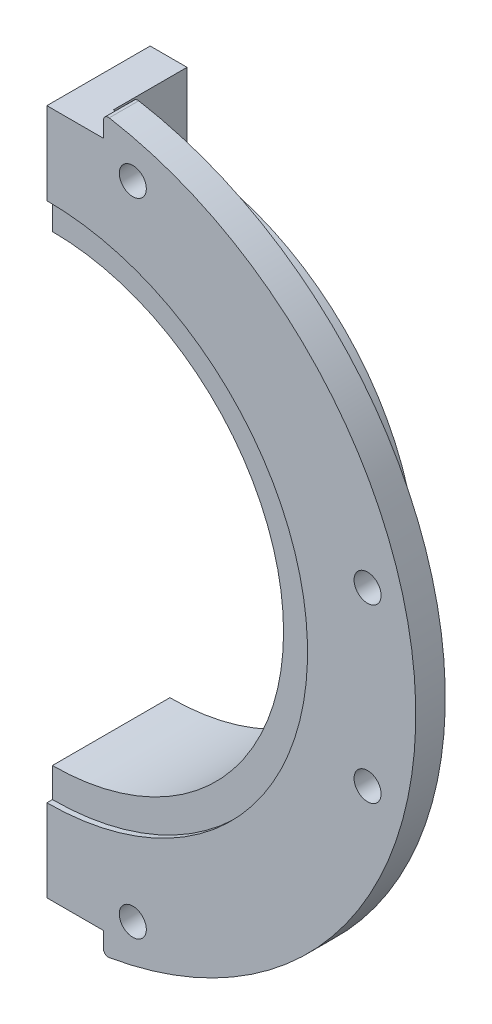
from build123d import *

# Parameters (mm, degrees)
SKETCH1_W                = 180
SKETCH1_H                = 180
BOSS_EXTRUDE1_DEPTH      = 6
SKETCH2_R                = 50.3
SKETCH2_R_2              = 46.3
BOSS_EXTRUDE2_DEPTH      = 19
CUT_EXTRUDE1_DEPTH       = 256.266527379
CUT_EXTRUDE1_DEPTH_BACK  = 256.266527379
SKETCH3_R                = 47
BOSS_EXTRUDE3_DEPTH      = 60
FILLET4_R                = 3
M5_CLEARANCE_HOLE1_D     = 5.5
CUT_EXTRUDE4_REACH       = 264.975
CUT_EXTRUDE5_REACH       = 244.499
SKETCH33_W               = 1
SKETCH33_H               = 25
SKETCH35_W               = 15
SKETCH35_H               = 20
BOSS_EXTRUDE6_DEPTH      = 15
M5_CLEARANCE_HOLE2_D     = 5.5
CUT_EXTRUDE6_DEPTH       = 4.2
CUT_EXTRUDE7_REACH       = 242.936
SKETCH41_W               = 23
SKETCH41_H               = 15
FILLET8_R                = 1
CUT_EXTRUDE8_REACH       = 197.694
SKETCH47_R               = 53
CUT_EXTRUDE10_DEPTH      = 1.12
CUT_EXTRUDE12_DEPTH      = 237.907606822
CUT_EXTRUDE12_DEPTH_BACK = 237.907606822
SKETCH51_W               = 150
SKETCH51_H               = 200
LETTERS_START            = -1
LETTERS_DEPTH            = 1


# Read off the part's stored shape, not the designer's step: letters
with BuildPart() as part:
    # Sketch1 → Boss-Extrude1 (new body)
    with BuildSketch(Plane.XY):
        with Locations((90, 90)):
            Rectangle(SKETCH1_W, SKETCH1_H)
    extrude(amount=BOSS_EXTRUDE1_DEPTH)

    # Sketch2 → Boss-Extrude2 (add)
    with BuildSketch(Plane(origin=(0, 0, 0), x_dir=(-1, 0, 0), z_dir=(0, 0, -1))):
        with Locations((-90, 90)):
            Circle(SKETCH2_R)
        with Locations((-90, 90)):
            Circle(SKETCH2_R_2, mode=Mode.SUBTRACT)
    extrude(amount=BOSS_EXTRUDE2_DEPTH)

    # Sketch3 → Cut-Extrude1 (cut, two sides: drawn at the far end of the back side and taken through both)
    with BuildSketch(Plane(origin=(0, 0, 0), x_dir=(-1, 0, 0), z_dir=(0, 0, -1)).offset(-CUT_EXTRUDE1_DEPTH_BACK)):
        with Locations((-90, 90)):
            Circle(SKETCH3_R)
    extrude(amount=CUT_EXTRUDE1_DEPTH + CUT_EXTRUDE1_DEPTH_BACK, mode=Mode.SUBTRACT)

    # Sketch4 → Boss-Extrude3 (add)
    with BuildSketch(Plane(origin=(0, 0, 0), x_dir=(-1, 0, 0), z_dir=(0, 0, -1))):
        with BuildLine():
            Line((0, 77.5), (0, 102.5))
            Line((0, 102.5), (-41.277931078, 102.5))
            ThreePointArc((-41.277931078, 102.5), (-39.7, 90), (-41.277931078, 77.5))
            Line((-41.277931078, 77.5), (0, 77.5))
        make_face()
    extrude(amount=BOSS_EXTRUDE3_DEPTH)

    # Fillet4
    fillet4_edges = [part.edges().sort_by_distance(p)[0] for p in [
        (41.277931078, 102.5, -9.5),
        (41.277931078, 77.5, -9.5),
    ]]
    fillet(fillet4_edges, radius=FILLET4_R)

    # M5 Clearance Hole1 (through all)
    with Locations(Plane(origin=(0, 0, 0), x_dir=(-1, 0, 0), z_dir=(0, 0, -1))):
        with Locations((-107.470285544, 155.199993275), (-155.199993275, 107.470285544), (-155.199993275, 72.529714456), (-107.470285544, 24.800006725), (-72.529714456, 24.800006725), (-24.800006725, 72.529714456), (-24.800006725, 107.470285544), (-72.529714456, 155.199993275)):
            Hole(M5_CLEARANCE_HOLE1_D / 2)

    # Sketch31 → Cut-Extrude4 (cut, up to next)
    with BuildSketch(Plane.XY.offset(6), mode=Mode.PRIVATE) as cut_extrude4_sk1:
        with BuildLine():
            Line((0, 180), (0, 102.5))
            Line((0, 102.5), (16.049002711, 102.5))
            ThreePointArc((16.049002711, 102.5), (165, 90), (16.049002711, 77.5))
            Line((16.049002711, 77.5), (0, 77.5))
            Line((0, 77.5), (0, 0))
            Line((0, 0), (180, 0))
            Line((180, 0), (180, 180))
            Line((180, 180), (0, 180))
        make_face()
    cut_extrude4_tool1 = extrude(cut_extrude4_sk1.sketch, amount=-CUT_EXTRUDE4_REACH, mode=Mode.PRIVATE) & part.part
    add(cut_extrude4_tool1.solids().sort_by_distance((2.545584, 141.25, 6))[0], mode=Mode.SUBTRACT)

    # Sketch33 → Cut-Extrude5 (cut, up to next)
    with BuildSketch(Plane.XY.offset(6), mode=Mode.PRIVATE) as cut_extrude5_sk1:
        with Locations((0.5, 90)):
            Rectangle(SKETCH33_W, SKETCH33_H)
    cut_extrude5_tool1 = extrude(cut_extrude5_sk1.sketch, amount=-CUT_EXTRUDE5_REACH, mode=Mode.PRIVATE) & part.part
    add(cut_extrude5_tool1.solids().sort_by_distance((0.5, 90, 6))[0], mode=Mode.SUBTRACT)

    # Sketch35 → Boss-Extrude6 (add)
    with BuildSketch(Plane(origin=(0, 0, 0), x_dir=(-1, 0, 0), z_dir=(0, 0, -1))):
        with Locations((-90, 149.73771205)):
            Rectangle(SKETCH35_W, SKETCH35_H)
        with Locations((-90, 30.26228795)):
            Rectangle(SKETCH35_W, SKETCH35_H)
    extrude(amount=BOSS_EXTRUDE6_DEPTH)

    # M5 Clearance Hole2 (through all)
    with Locations(Plane(origin=(97.5, 0, 0), x_dir=(0, 0, -1), z_dir=(1, 0, 0))):
        with Locations((7.5, 149.73771205), (7.5, 30.26228795)):
            Hole(M5_CLEARANCE_HOLE2_D / 2)

    # Sketch40 → Cut-Extrude6 (cut)
    with BuildSketch(Plane.ZY.offset(-82.5)):
        Polygon((-11.75, 147.283973406), (-7.5, 144.830234762), (-3.25, 147.283973406), (-3.25, 152.191450694), (-7.5, 154.645189338), (-11.75, 152.191450694), align=None)
        Polygon((-3.25, 27.808549306), (-3.25, 32.716026594), (-7.5, 35.169765238), (-11.75, 32.716026594), (-11.75, 27.808549306), (-7.5, 25.354810662), align=None)
    extrude(amount=-CUT_EXTRUDE6_DEPTH, mode=Mode.SUBTRACT)

    # Sketch41 → Cut-Extrude7 (cut, up to next)
    with BuildSketch(Plane(origin=(0, 0, 0), x_dir=(-1, 0, 0), z_dir=(0, 0, -1)), mode=Mode.PRIVATE) as cut_extrude7_sk1:
        with Locations((-90, 167.23771205)):
            Rectangle(SKETCH41_W, SKETCH41_H)
    cut_extrude7_tool1 = extrude(cut_extrude7_sk1.sketch, amount=-CUT_EXTRUDE7_REACH, mode=Mode.PRIVATE) & part.part
    # Sketch41 → Cut-Extrude7 (cut, up to next)
    with BuildSketch(Plane(origin=(0, 0, 0), x_dir=(-1, 0, 0), z_dir=(0, 0, -1)), mode=Mode.PRIVATE) as cut_extrude7_sk2:
        with Locations((-90, 12.76228795)):
            Rectangle(SKETCH41_W, SKETCH41_H)
    cut_extrude7_tool2 = extrude(cut_extrude7_sk2.sketch, amount=-CUT_EXTRUDE7_REACH, mode=Mode.PRIVATE) & part.part
    add(cut_extrude7_tool1.solids().sort_by_distance((90, 167.237712, 0))[0], mode=Mode.SUBTRACT)
    add(cut_extrude7_tool2.solids().sort_by_distance((90, 12.762288, 0))[0], mode=Mode.SUBTRACT)

    # Fillet8
    fillet8_edges = [part.edges().sort_by_distance(p)[0] for p in [
        (101.5, 164.113089262, 3),
        (78.5, 164.113089262, 3),
        (78.5, 15.886910738, 3),
        (101.5, 15.886910738, 3),
    ]]
    fillet(fillet8_edges, radius=FILLET8_R)

    # Sketch42 → Cut-Extrude8 (cut, up to next)
    with BuildSketch(Plane(origin=(0, 102.5, 0), x_dir=(1, 0, 0), z_dir=(0, 1, 0)), mode=Mode.PRIVATE) as cut_extrude8_sk1:
        Polygon((15, -6), (1, 24), (1, -6), align=None)
    cut_extrude8_tool1 = extrude(cut_extrude8_sk1.sketch, amount=-CUT_EXTRUDE8_REACH, mode=Mode.PRIVATE) & part.part
    add(cut_extrude8_tool1.solids().sort_by_distance((5.666667, 102.5, -4))[0], mode=Mode.SUBTRACT)

    # Sketch47 → Cut-Extrude10 (cut)
    with BuildSketch(Plane.XY.offset(6)):
        with Locations((90, 90)):
            Circle(SKETCH47_R)
    extrude(amount=-CUT_EXTRUDE10_DEPTH, mode=Mode.SUBTRACT)

    # Sketch51 → Cut-Extrude12 (cut, two sides: drawn at the far end of the back side and taken through both)
    with BuildSketch(Plane(origin=(0, 0, -15), x_dir=(-1, 0, 0), z_dir=(0, 0, -1)).offset(-CUT_EXTRUDE12_DEPTH_BACK)):
        with Locations((-15, 90)):
            Rectangle(SKETCH51_W, SKETCH51_H)
    extrude(amount=CUT_EXTRUDE12_DEPTH + CUT_EXTRUDE12_DEPTH_BACK, mode=Mode.SUBTRACT)

    # letters outline → letters (cut)
    # profile 1 of 5: a face of its own
    with BuildSketch(Plane(origin=(0, 0, 0), x_dir=(-1, 0, 0), z_dir=(0, 0, -1)).offset(LETTERS_START)):
        with BuildLine():
            add(Edge.make_bspline(
                [(-141.293732073, 110.226370217), (-141.304534853, 110.202635256), (-141.324051762, 110.159754339), (-141.365116513, 110.109567701), (-141.411365915, 110.0772724), (-141.480929406, 110.07123694), (-141.568083465, 110.088873528), (-141.635628598, 110.11409642), (-141.67089977, 110.127267481)],
                knots=[0, 0, 0, 0, 0.170137661, 0.307380271, 0.421669693, 0.527781886, 0.753413963, 1, 1, 1, 1], degree=3))
            Line((-141.293732073, 110.226370217), (-140.359472293, 112.406630426))
            add(Edge.make_bspline(
                [(-140.430672317, 112.623116986), (-140.413806473, 112.612134059), (-140.381218977, 112.590913295), (-140.351073852, 112.537804355), (-140.344536466, 112.473740966), (-140.354226354, 112.430201787), (-140.359472293, 112.406630426)],
                knots=[0, 0, 0, 0, 0.24007891, 0.463870662, 0.709748819, 1, 1, 1, 1], degree=3))
            Line((-140.430672317, 112.623116986), (-142.281872953, 113.673798428))
            add(Edge.make_bspline(
                [(-142.528186551, 113.616068679), (-142.51122067, 113.630524242), (-142.47809265, 113.658750549), (-142.416954543, 113.684137747), (-142.349550716, 113.688268283), (-142.305144536, 113.678774013), (-142.281872953, 113.673798428)],
                knots=[0, 0, 0, 0, 0.250468316, 0.489070952, 0.732241602, 1, 1, 1, 1], degree=3))
            Line((-142.528186551, 113.616068679), (-142.676359575, 113.266803694))
            Line((-142.676359575, 113.266803694), (-142.676359575, 112.769365685))
            Line((-142.676359575, 112.769365685), (-142.989062385, 112.034273541))
            Line((-142.989062385, 112.034273541), (-143.264240858, 111.704251806))
            Line((-143.264240858, 111.704251806), (-143.544230143, 111.51278147))
            Line((-143.544230143, 111.51278147), (-143.835765379, 111.448316583))
            Line((-143.835765379, 111.448316583), (-144.242760113, 111.476219295))
            Line((-144.242760113, 111.476219295), (-144.58144131, 111.620543669))
            Line((-144.58144131, 111.620543669), (-144.892219795, 111.891873492))
            Line((-144.892219795, 111.891873492), (-145.073106344, 112.171862777))
            Line((-145.073106344, 112.171862777), (-145.128911769, 112.469170988))
            Line((-145.128911769, 112.469170988), (-145.097160406, 112.889635997))
            Line((-145.097160406, 112.889635997), (-144.861430596, 113.443841593))
            add(Edge.make_bspline(
                [(-144.417873687, 113.886436339), (-144.436786999, 113.876682564), (-144.47591575, 113.856503495), (-144.531184276, 113.814467019), (-144.586549746, 113.763594105), (-144.660544919, 113.683021769), (-144.750684772, 113.574293544), (-144.82446257, 113.487387713), (-144.861430596, 113.443841593)],
                knots=[0, 0, 0, 0, 0.10098505, 0.208922619, 0.328699201, 0.458128073, 0.728482884, 1, 1, 1, 1], degree=3))
            Line((-144.417873687, 113.886436339), (-144.084003302, 113.921074189))
            add(Edge.make_bspline(
                [(-143.851159978, 114.1260148), (-143.865554619, 114.0953789), (-143.891995016, 114.039106196), (-143.947362905, 113.972225195), (-144.012186402, 113.928069954), (-144.0603134, 113.923381849), (-144.084003302, 113.921074189)],
                knots=[0, 0, 0, 0, 0.307616452, 0.565036746, 0.785894886, 1, 1, 1, 1], degree=3))
            add(Edge.make_bspline(
                [(-143.831916729, 114.194328337), (-143.834885812, 114.181431414), (-143.840200505, 114.158345777), (-143.847804152, 114.13591465), (-143.851159978, 114.1260148)],
                knots=[0, 0, 0, 0, 0.558655732, 1, 1, 1, 1], degree=3))
            add(Edge.make_bspline(
                [(-143.802089691, 114.265528361), (-143.802351973, 114.263587858), (-143.803310861, 114.256493483), (-143.81033716, 114.242778497), (-143.819178094, 114.22073477), (-143.827297206, 114.203904333), (-143.831916729, 114.194328337)],
                knots=[0, 0, 0, 0, 0.075633654, 0.276512626, 0.588358171, 1, 1, 1, 1], degree=3))
            add(Edge.make_bspline(
                [(-143.774186979, 114.306901349), (-143.778497833, 114.299403419), (-143.786811214, 114.284943838), (-143.797124363, 114.271838166), (-143.802089691, 114.265528361)],
                knots=[0, 0, 0, 0, 0.518543991, 1, 1, 1, 1], degree=3))
            add(Edge.make_bspline(
                [(-143.92909514, 114.613831184), (-143.910019516, 114.60486352), (-143.874519753, 114.588174684), (-143.826683629, 114.559747074), (-143.791112348, 114.526753232), (-143.764102943, 114.492244618), (-143.748586898, 114.452550029), (-143.746701325, 114.407920751), (-143.755062549, 114.358346139), (-143.76745957, 114.324998106), (-143.774186979, 114.306901349)],
                knots=[0, 0, 0, 0, 0.158873685, 0.295664156, 0.41709815, 0.522464187, 0.623443337, 0.732432938, 0.854801146, 1, 1, 1, 1], degree=3))
            Line((-143.92909514, 114.613831184), (-144.523711561, 114.579193334))
            Line((-144.523711561, 114.579193334), (-144.898954933, 114.410814898))
            Line((-144.898954933, 114.410814898), (-145.427182141, 113.821971452))
            Line((-145.427182141, 113.821971452), (-145.737960626, 113.090727958))
            Line((-145.737960626, 113.090727958), (-145.819744438, 112.227668202))
            add(Edge.make_bspline(
                [(-145.532057853, 111.49738687), (-145.558101585, 111.561183384), (-145.609333228, 111.686680004), (-145.68373622, 111.872137034), (-145.752424669, 112.052222514), (-145.797595974, 112.169945893), (-145.819744438, 112.227668202)],
                knots=[0, 0, 0, 0, 0.263365131, 0.518075853, 0.763702209, 1, 1, 1, 1], degree=3))
            Line((-145.532057853, 111.49738687), (-144.94417657, 110.974932637))
            Line((-144.94417657, 110.974932637), (-144.492922361, 110.782500138))
            Line((-144.492922361, 110.782500138), (-143.702024792, 110.720921739))
            add(Edge.make_bspline(
                [(-142.974629948, 111.026889411), (-143.091217661, 110.976489487), (-143.332676113, 110.872108954), (-143.576124799, 110.772456969), (-143.702024792, 110.720921739)],
                knots=[0, 0, 0, 0, 0.482847928, 1, 1, 1, 1], degree=3))
            Line((-142.974629948, 111.026889411), (-142.431970302, 111.654219356))
            Line((-142.431970302, 111.654219356), (-142.114456679, 112.384500688))
            add(Edge.make_bspline(
                [(-142.099062079, 112.772252173), (-142.096206649, 112.767879183), (-142.089009895, 112.75685761), (-142.085886882, 112.732171888), (-142.08397884, 112.698898289), (-142.085644387, 112.655451861), (-142.088282492, 112.602198807), (-142.094405267, 112.538675465), (-142.102995176, 112.464890344), (-142.110480753, 112.412387374), (-142.114456679, 112.384500688)],
                knots=[0, 0, 0, 0, 0.039578122, 0.099751686, 0.185800412, 0.296281572, 0.431481448, 0.594148527, 0.784434046, 1, 1, 1, 1], degree=3))
            Line((-142.099062079, 112.772252173), (-141.173169132, 112.202037614))
            Line((-141.173169132, 112.202037614), (-141.894121468, 110.504435178))
            Line((-141.894121468, 110.504435178), (-141.918175531, 110.383202704))
            add(Edge.make_bspline(
                [(-141.824845769, 110.19269453), (-141.836303501, 110.204119995), (-141.85972726, 110.227477787), (-141.885513558, 110.272661646), (-141.905793927, 110.324907933), (-141.913918205, 110.363158463), (-141.918175531, 110.383202704)],
                knots=[0, 0, 0, 0, 0.22387156, 0.457674626, 0.715807849, 1, 1, 1, 1], degree=3))
            Line((-141.824845769, 110.19269453), (-141.67089977, 110.127267481))
        make_face()
    # profile 2 of 5: a face of its own
    with BuildSketch(Plane(origin=(0, 0, 0), x_dir=(-1, 0, 0), z_dir=(0, 0, -1)).offset(LETTERS_START)):
        with BuildLine():
            add(Edge.make_bspline(
                [(-139.106917559, 114.90723332), (-139.116647435, 114.890823739), (-139.135892213, 114.858367135), (-139.173818811, 114.816618291), (-139.218991056, 114.782918764), (-139.253141012, 114.767734356), (-139.270485183, 114.760022459)],
                knots=[0, 0, 0, 0, 0.254068984, 0.502524504, 0.747340814, 1, 1, 1, 1], degree=3))
            add(Edge.make_bspline(
                [(-139.088636472, 115.034238769), (-139.085116702, 115.013787189), (-139.077528202, 114.969694305), (-139.096659774, 114.929034115), (-139.106917559, 114.90723332)],
                knots=[0, 0, 0, 0, 0.463829487, 1, 1, 1, 1], degree=3))
            Line((-139.088636472, 115.034238769), (-139.383058195, 115.982930987))
            Line((-139.383058195, 115.982930987), (-139.374398732, 116.473633858))
            add(Edge.make_bspline(
                [(-139.532193381, 116.686271769), (-139.508671147, 116.672535923), (-139.46489748, 116.646974222), (-139.413900875, 116.595750365), (-139.380659073, 116.537335615), (-139.376487196, 116.494884912), (-139.374398732, 116.473633858)],
                knots=[0, 0, 0, 0, 0.292605336, 0.544523468, 0.771985958, 1, 1, 1, 1], degree=3))
            Line((-139.532193381, 116.686271769), (-139.60146908, 116.722833944))
            add(Edge.make_bspline(
                [(-140.026744902, 116.612185257), (-140.013899074, 116.635674751), (-139.9903884, 116.678665662), (-139.949554504, 116.732125217), (-139.910424389, 116.771983797), (-139.866708855, 116.796207965), (-139.81498907, 116.801259782), (-139.754120431, 116.789549128), (-139.681251853, 116.762328228), (-139.62976539, 116.736841259), (-139.60146908, 116.722833944)],
                knots=[0, 0, 0, 0, 0.152441599, 0.279001467, 0.382488099, 0.46919861, 0.557665655, 0.672518576, 0.820020349, 1, 1, 1, 1], degree=3))
            Line((-140.026744902, 116.612185257), (-140.043101665, 115.993514774))
            Line((-140.043101665, 115.993514774), (-139.892042153, 115.854001213))
            Line((-139.892042153, 115.854001213), (-143.302908189, 117.648434261))
            Line((-143.302908189, 117.648434261), (-143.437610938, 117.718672123))
            add(Edge.make_bspline(
                [(-143.640627224, 117.647472099), (-143.626485471, 117.661103255), (-143.599063549, 117.687535092), (-143.54846038, 117.713164469), (-143.493470665, 117.724447135), (-143.456550047, 117.720630127), (-143.437610938, 117.718672123)],
                knots=[0, 0, 0, 0, 0.261212351, 0.50651039, 0.746855458, 1, 1, 1, 1], degree=3))
            Line((-143.640627224, 117.647472099), (-143.83594621, 117.276077377))
            add(Edge.make_bspline(
                [(-143.771481323, 117.029763779), (-143.783617374, 117.044614316), (-143.808690132, 117.075295131), (-143.829734454, 117.134375538), (-143.840762439, 117.202244538), (-143.837622517, 117.250379573), (-143.83594621, 117.276077377)],
                knots=[0, 0, 0, 0, 0.217900463, 0.450176555, 0.706466289, 1, 1, 1, 1], degree=3))
            Line((-143.771481323, 117.029763779), (-139.453296057, 114.758098134))
            add(Edge.make_bspline(
                [(-139.270485183, 114.760022459), (-139.28765256, 114.754294104), (-139.319867462, 114.74354474), (-139.368488344, 114.737154285), (-139.413654951, 114.741304082), (-139.440340837, 114.752609623), (-139.453296057, 114.758098134)],
                knots=[0, 0, 0, 0, 0.287914812, 0.540277522, 0.776818153, 1, 1, 1, 1], degree=3))
        make_face()
    # profile 3 of 5: a face of its own
    with BuildSketch(Plane(origin=(0, 0, 0), x_dir=(-1, 0, 0), z_dir=(0, 0, -1)).offset(LETTERS_START)):
        with BuildLine():
            add(Edge.make_bspline(
                [(-137.202397354, 122.989809613), (-137.223371361, 122.973030929), (-137.26297175, 122.941351603), (-137.327545828, 122.90736505), (-137.392598469, 122.889774361), (-137.435473495, 122.890400936), (-137.456408252, 122.890706876)],
                knots=[0, 0, 0, 0, 0.287258324, 0.542363756, 0.776548155, 1, 1, 1, 1], degree=3))
            Line((-137.202397354, 122.989809613), (-134.828742485, 126.125497177))
            add(Edge.make_bspline(
                [(-134.791218148, 126.234221538), (-134.79577411, 126.213377529), (-134.80402553, 126.175626411), (-134.821096934, 126.141003359), (-134.828742485, 126.125497177)],
                knots=[0, 0, 0, 0, 0.552142821, 1, 1, 1, 1], degree=3))
            add(Edge.make_bspline(
                [(-134.887434397, 126.438199987), (-134.872278826, 126.4254168), (-134.84271404, 126.400479952), (-134.810797111, 126.351380888), (-134.793090358, 126.294758451), (-134.791856879, 126.254874562), (-134.791218148, 126.234221538)],
                knots=[0, 0, 0, 0, 0.252224429, 0.492027717, 0.736957362, 1, 1, 1, 1], degree=3))
            Line((-134.887434397, 126.438199987), (-135.043304721, 126.555583811))
            add(Edge.make_bspline(
                [(-135.356007531, 126.578675711), (-135.345063728, 126.587411198), (-135.324017288, 126.604210741), (-135.288592131, 126.622382126), (-135.250972378, 126.630979672), (-135.212030286, 126.631916762), (-135.171673019, 126.624660549), (-135.129710519, 126.609899862), (-135.086358493, 126.5862369), (-135.058166489, 126.566164977), (-135.043304721, 126.555583811)],
                knots=[0, 0, 0, 0, 0.121820513, 0.234277612, 0.343387544, 0.455183227, 0.571395613, 0.698638567, 0.84113354, 1, 1, 1, 1], degree=3))
            Line((-135.356007531, 126.578675711), (-137.742170513, 123.412198947))
            Line((-137.742170513, 123.412198947), (-137.788354312, 123.307323236))
            add(Edge.make_bspline(
                [(-137.758527275, 123.102382625), (-137.765250645, 123.11203269), (-137.780764756, 123.134300121), (-137.790131244, 123.180542421), (-137.793694889, 123.239282744), (-137.790268407, 123.282937121), (-137.788354312, 123.307323236)],
                knots=[0, 0, 0, 0, 0.16516666, 0.381120473, 0.654282841, 1, 1, 1, 1], degree=3))
            add(Edge.make_bspline(
                [(-137.682516438, 123.043690713), (-137.697121291, 123.054052729), (-137.723253738, 123.072593475), (-137.74773018, 123.09326428), (-137.758527275, 123.102382625)],
                knots=[0, 0, 0, 0, 0.558878081, 1, 1, 1, 1], degree=3))
            add(Edge.make_bspline(
                [(-137.610354251, 122.986923126), (-137.620317577, 122.994593692), (-137.644569171, 123.013264514), (-137.668447868, 123.032410504), (-137.682516438, 123.043690713)],
                knots=[0, 0, 0, 0, 0.410831762, 1, 1, 1, 1], degree=3))
            add(Edge.make_bspline(
                [(-137.456408252, 122.890706876), (-137.485768883, 122.908067817), (-137.537876182, 122.938878862), (-137.588329572, 122.972323406), (-137.610354251, 122.986923126)],
                knots=[0, 0, 0, 0, 0.563464823, 1, 1, 1, 1], degree=3))
        make_face()
    # profile 4 of 5: a face of its own
    with BuildSketch(Plane(origin=(0, 0, 0), x_dir=(-1, 0, 0), z_dir=(0, 0, -1)).offset(LETTERS_START)):
        with BuildLine():
            add(Edge.make_bspline(
                [(-128.442379201, 129.409092659), (-128.460149203, 129.392393718), (-128.493521598, 129.361032798), (-128.548395204, 129.326582125), (-128.600782851, 129.301160324), (-128.636824268, 129.295416841), (-128.65405495, 129.292670997)],
                knots=[0, 0, 0, 0, 0.296622873, 0.557063277, 0.788240797, 1, 1, 1, 1], degree=3))
            add(Edge.make_bspline(
                [(-128.370217014, 129.570735957), (-128.371148632, 129.555548363), (-128.372971588, 129.525829816), (-128.387414924, 129.482822891), (-128.410501, 129.44326536), (-128.43165002, 129.420594095), (-128.442379201, 129.409092659)],
                knots=[0, 0, 0, 0, 0.250195537, 0.489573755, 0.74105393, 1, 1, 1, 1], degree=3))
            Line((-128.370217014, 129.570735957), (-129.079330772, 134.021699648))
            Line((-129.079330772, 134.021699648), (-129.143795659, 134.112142923))
            add(Edge.make_bspline(
                [(-129.422822781, 134.140045635), (-129.401082536, 134.153163777), (-129.359523814, 134.178240458), (-129.284808155, 134.184789642), (-129.209716975, 134.162710332), (-129.166898599, 134.129864897), (-129.143795659, 134.112142923)],
                knots=[0, 0, 0, 0, 0.247143755, 0.472440796, 0.715351906, 1, 1, 1, 1], degree=3))
            Line((-129.422822781, 134.140045635), (-130.953623307, 132.672747834))
            Line((-130.953623307, 132.672747834), (-131.58383974, 133.330866979))
            Line((-131.58383974, 133.330866979), (-131.643493814, 133.367429153))
            add(Edge.make_bspline(
                [(-131.844585775, 133.353958878), (-131.829197707, 133.362196248), (-131.799035146, 133.378342534), (-131.747802918, 133.387739991), (-131.694864502, 133.385099554), (-131.660941965, 133.373430938), (-131.643493814, 133.367429153)],
                knots=[0, 0, 0, 0, 0.248912457, 0.487899916, 0.7365999, 1, 1, 1, 1], degree=3))
            Line((-131.844585775, 133.353958878), (-132.133234523, 133.077818243))
            add(Edge.make_bspline(
                [(-132.15151561, 132.813223558), (-132.157199254, 132.83166401), (-132.169147353, 132.870429348), (-132.169741983, 132.935041865), (-132.157341477, 133.00525648), (-132.141593188, 133.05265872), (-132.133234523, 133.077818243)],
                knots=[0, 0, 0, 0, 0.212820379, 0.447388899, 0.706692526, 1, 1, 1, 1], degree=3))
            Line((-132.15151561, 132.813223558), (-131.507828903, 132.141634138))
            Line((-131.507828903, 132.141634138), (-131.943688512, 131.724055616))
            Line((-131.943688512, 131.724055616), (-132.019699349, 131.624952879))
            add(Edge.make_bspline(
                [(-132.029320974, 131.371904144), (-132.036075509, 131.390936656), (-132.049744492, 131.429452274), (-132.052212685, 131.492477151), (-132.043688204, 131.558785827), (-132.027987406, 131.602092416), (-132.019699349, 131.624952879)],
                knots=[0, 0, 0, 0, 0.232047306, 0.469588308, 0.720008954, 1, 1, 1, 1], degree=3))
            add(Edge.make_bspline(
                [(-131.985061499, 131.329568994), (-131.987910009, 131.341913727), (-131.993447383, 131.365911328), (-132.017595175, 131.369945306), (-132.029320974, 131.371904144)],
                knots=[0, 0, 0, 0, 0.514415264, 1, 1, 1, 1], degree=3))
            add(Edge.make_bspline(
                [(-131.930218237, 131.25836897), (-131.938664178, 131.268548997), (-131.957803297, 131.291617683), (-131.975290987, 131.315965612), (-131.985061499, 131.329568994)],
                knots=[0, 0, 0, 0, 0.441292024, 1, 1, 1, 1], degree=3))
            add(Edge.make_bspline(
                [(-131.771461426, 131.133287845), (-131.801323062, 131.152961763), (-131.85779972, 131.190170613), (-131.907021926, 131.236524415), (-131.930218237, 131.25836897)],
                knots=[0, 0, 0, 0, 0.528742968, 1, 1, 1, 1], degree=3))
            add(Edge.make_bspline(
                [(-131.523223503, 131.18139597), (-131.551213921, 131.169058158), (-131.601203082, 131.147023587), (-131.671017972, 131.127694424), (-131.727811634, 131.11824872), (-131.758423516, 131.128795756), (-131.771461426, 131.133287845)],
                knots=[0, 0, 0, 0, 0.352831588, 0.63013547, 0.842470956, 1, 1, 1, 1], degree=3))
            Line((-131.523223503, 131.18139597), (-131.035407119, 131.649006942))
            Line((-131.035407119, 131.649006942), (-128.848411773, 129.366757509))
            add(Edge.make_bspline(
                [(-128.65405495, 129.292670997), (-128.675318843, 129.295724186), (-128.715091489, 129.301434966), (-128.769367024, 129.316408282), (-128.814586769, 129.337049556), (-128.837561847, 129.357228195), (-128.848411773, 129.366757509)],
                knots=[0, 0, 0, 0, 0.30405098, 0.568706394, 0.796322606, 1, 1, 1, 1], degree=3))
        make_face()
        Polygon((-129.593125543, 133.030672281), (-129.138022684, 130.778249886), (-130.481201523, 132.180120637), align=None, mode=Mode.SUBTRACT)
    # profile 5 of 5: a face of its own
    with BuildSketch(Plane(origin=(0, 0, 0), x_dir=(-1, 0, 0), z_dir=(0, 0, -1)).offset(LETTERS_START)):
        with BuildLine():
            add(Edge.make_bspline(
                [(-123.442446603, 133.809871726), (-123.468010499, 133.802904963), (-123.514268432, 133.790298589), (-123.577256487, 133.780711691), (-123.627474244, 133.777742556), (-123.654226855, 133.786768358), (-123.665668301, 133.790628476)],
                knots=[0, 0, 0, 0, 0.348561353, 0.6307226, 0.842068964, 1, 1, 1, 1], degree=3))
            add(Edge.make_bspline(
                [(-123.305819529, 133.921482575), (-123.32698133, 133.904156584), (-123.372482721, 133.866902824), (-123.418064182, 133.82974707), (-123.442446603, 133.809871726)],
                knots=[0, 0, 0, 0, 0.465080327, 1, 1, 1, 1], degree=3))
            add(Edge.make_bspline(
                [(-123.230770854, 133.983060975), (-123.240373349, 133.975019706), (-123.265183592, 133.954243249), (-123.290376947, 133.933932377), (-123.305819529, 133.921482575)],
                knots=[0, 0, 0, 0, 0.387037534, 1, 1, 1, 1], degree=3))
            add(Edge.make_bspline(
                [(-123.18651138, 134.362152997), (-123.173656412, 134.345584118), (-123.149428309, 134.314356307), (-123.124986113, 134.263222634), (-123.111326861, 134.213533979), (-123.111521121, 134.164175467), (-123.123561798, 134.11615699), (-123.14723188, 134.068980527), (-123.184399668, 134.024329114), (-123.214660617, 133.997398316), (-123.230770854, 133.983060975)],
                knots=[0, 0, 0, 0, 0.143361416, 0.270197109, 0.385894742, 0.493610854, 0.604510072, 0.722482585, 0.852256074, 1, 1, 1, 1], degree=3))
            Line((-123.18651138, 134.362152997), (-127.644210208, 136.88013224))
            add(Edge.make_bspline(
                [(-127.852999469, 136.879170078), (-127.835653815, 136.887121727), (-127.802033651, 136.90253399), (-127.747584161, 136.910371611), (-127.69337237, 136.903877972), (-127.660881613, 136.888184667), (-127.644210208, 136.88013224)],
                knots=[0, 0, 0, 0, 0.261355715, 0.506571979, 0.746816043, 1, 1, 1, 1], degree=3))
            add(Edge.make_bspline(
                [(-128.02330223, 136.599180792), (-128.023271547, 136.621315639), (-128.023205409, 136.66902884), (-127.987237028, 136.739637118), (-127.930898023, 136.811913487), (-127.880573832, 136.855362733), (-127.852999469, 136.879170078)],
                knots=[0, 0, 0, 0, 0.192827534, 0.415653157, 0.67981616, 1, 1, 1, 1], degree=3))
            Line((-128.02330223, 136.599180792), (-126.471334129, 131.748919667))
            Line((-126.471334129, 131.748919667), (-126.435734117, 131.683492617))
            add(Edge.make_bspline(
                [(-126.115334007, 131.627687193), (-126.150772295, 131.620536192), (-126.215219527, 131.607531552), (-126.306605224, 131.60845529), (-126.38357104, 131.6325563), (-126.418758582, 131.666916309), (-126.435734117, 131.683492617)],
                knots=[0, 0, 0, 0, 0.315832534, 0.574365573, 0.794661066, 1, 1, 1, 1], degree=3))
            add(Edge.make_bspline(
                [(-125.975820446, 131.741222367), (-125.997343821, 131.72394658), (-126.044103269, 131.686415001), (-126.090366009, 131.648272629), (-126.115334007, 131.627687193)],
                knots=[0, 0, 0, 0, 0.460300049, 1, 1, 1, 1], degree=3))
            add(Edge.make_bspline(
                [(-125.899809609, 131.803762929), (-125.909726494, 131.795393346), (-125.934802245, 131.774230091), (-125.960366356, 131.753658416), (-125.975820446, 131.741222367)],
                knots=[0, 0, 0, 0, 0.39547712, 1, 1, 1, 1], degree=3))
            add(Edge.make_bspline(
                [(-125.779539297, 132.04334139), (-125.779444256, 132.021305144), (-125.779254327, 131.977268299), (-125.804317306, 131.913814619), (-125.842982483, 131.853471452), (-125.880246251, 131.82087563), (-125.899809609, 131.803762929)],
                knots=[0, 0, 0, 0, 0.235137284, 0.46989419, 0.721696168, 1, 1, 1, 1], degree=3))
            Line((-125.779539297, 132.04334139), (-126.972424379, 135.755056359))
            Line((-126.972424379, 135.755056359), (-123.665668301, 133.790628476))
        make_face()
    extrude(amount=LETTERS_DEPTH, mode=Mode.SUBTRACT)


solid = part.part
